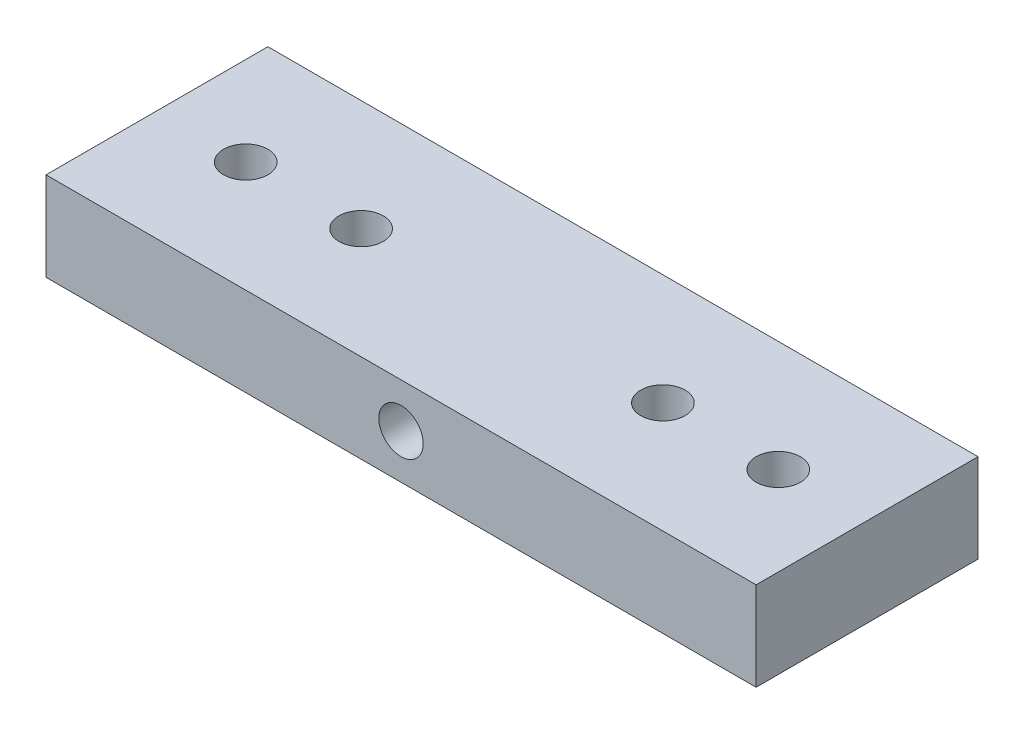
from build123d import *

# Parameters (mm, degrees)
SKETCH1_W           = 101.6
SKETCH1_H           = 31.75
SKETCH1_R           = 3.175
BOSS_EXTRUDE1_DEPTH = 12.7
SKETCH3_R           = 3.175
CUT_EXTRUDE1_DEPTH  = 25.4


with BuildPart() as part:
    # Sketch1 → Boss-Extrude1 (new body)
    with BuildSketch(Plane(origin=(0, 0, 0), x_dir=(1, 0, 0), z_dir=(0, 1, 0))):
        with Locations((19.385978836, 15.875)):
            Rectangle(SKETCH1_W, SKETCH1_H)
        with Locations((-18.714021164, 15.875)):
            Circle(SKETCH1_R, mode=Mode.SUBTRACT)
        with Locations((57.485978836, 15.875)):
            Circle(SKETCH1_R, mode=Mode.SUBTRACT)
        with Locations((-2.204021164, 15.875)):
            Circle(SKETCH1_R, mode=Mode.SUBTRACT)
        with Locations((40.975978836, 15.875)):
            Circle(SKETCH1_R, mode=Mode.SUBTRACT)
    extrude(amount=BOSS_EXTRUDE1_DEPTH)

    # Sketch3 → Cut-Extrude1 (cut)
    with BuildSketch(Plane.XY):
        with Locations((19.385978836, 6.35)):
            Circle(SKETCH3_R)
    extrude(amount=-CUT_EXTRUDE1_DEPTH, mode=Mode.SUBTRACT)


solid = part.part
